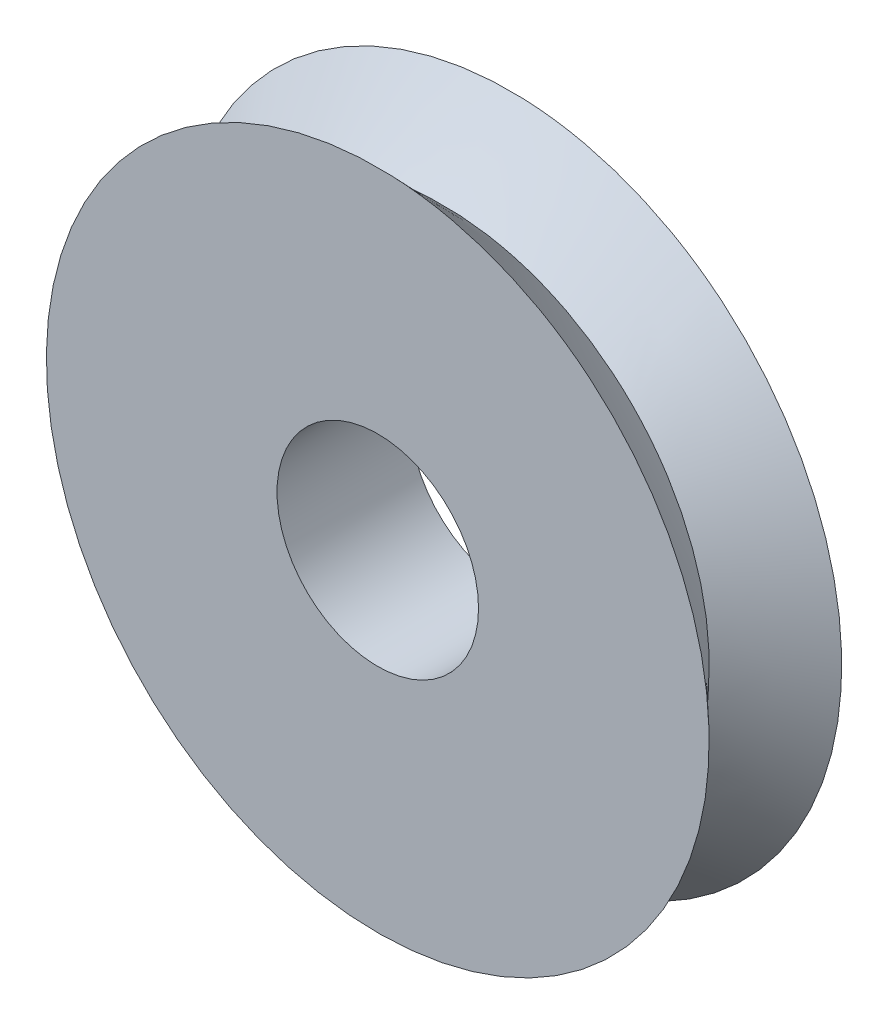
from build123d import *

# Parameters (mm, degrees)
CUT_EXTRUDE1_REACH = 9.348


with BuildPart() as part:
    # Loft1: read off the stored shape, not the designer's step
    # Loft1: loft between two sections, ruled curve by curve
    loft1_from = [
        Edge.make_bspline([(-2.206583483, -3.336313734, 0), (4.466043986, -7.749480699, 0), (8.879210951, -1.076853231, 0), (2.206583483, 3.336313734, 0), (-4.466043986, 7.749480699, 0), (-8.879210951, 1.076853231, 0), (-2.206583483, -3.336313734, 0)], [0, 0, 0, 0, 0.5, 0.5, 0.5, 1, 1, 1, 1], 3, [1, 0.333333333, 0.333333333, 1, 0.333333333, 0.333333333, 1]),
    ]
    loft1_to = [
        Edge.make_bspline([(-1.79672698, -4.666023163, 1), (7.535319346, -8.259477123, 1), (11.128773306, 1.072569203, 1), (1.79672698, 4.666023163, 1), (-7.535319346, 8.259477123, 1), (-11.128773306, -1.072569203, 1), (-1.79672698, -4.666023163, 1)], [0, 0, 0, 0, 0.5, 0.5, 0.5, 1, 1, 1, 1], 3, [1, 0.333333333, 0.333333333, 1, 0.333333333, 0.333333333, 1]),
    ]
    loft1 = Solid(Shell([*[Face.make_surface_from_curves(loft1_from[k], loft1_to[k]) for k in range(1)], Face(Wire(loft1_from)), Face(Wire(loft1_to))]))
    add(loft1)

    # Mirror1: part across plane


with BuildPart() as part_1:
    add(part.part)
    add(part.part.mirror(Plane.XY))

    # Sketch3 → Cut-Extrude1 (cut, up to next)
    with BuildSketch(Plane.XY.offset(1), mode=Mode.PRIVATE) as cut_extrude1_sk1:
        with BuildLine():
            ThreePointArc((-1.404991103, 0.58), (-1.263328936, -0.845221864), (0, -1.52))
            Line((0, -1.52), (0, 0.58))
            Line((0, 0.58), (-1.404991103, 0.58))
        make_face()
    cut_extrude1_tool1 = extrude(cut_extrude1_sk1.sketch, amount=-CUT_EXTRUDE1_REACH, mode=Mode.PRIVATE) & part_1.part
    # Sketch3 → Cut-Extrude1 (cut, up to next)
    with BuildSketch(Plane.XY.offset(1), mode=Mode.PRIVATE) as cut_extrude1_sk2:
        with BuildLine():
            Line((0, 0.58), (0, -1.52))
            ThreePointArc((0, -1.52), (1.074802307, -1.074802307), (1.52, 0))
            ThreePointArc((1.52, 0), (1.490970569, 0.295646345), (1.404991103, 0.58))
            Line((1.404991103, 0.58), (0, 0.58))
        make_face()
    cut_extrude1_tool2 = extrude(cut_extrude1_sk2.sketch, amount=-CUT_EXTRUDE1_REACH, mode=Mode.PRIVATE) & part_1.part
    # Sketch3 → Cut-Extrude1 (cut, up to next)
    with BuildSketch(Plane.XY.offset(1), mode=Mode.PRIVATE) as cut_extrude1_sk3:
        with BuildLine():
            ThreePointArc((-1.404991103, 0.58), (-1.263328936, -0.845221864), (0, -1.52))
            Line((0, -1.52), (0, 0.58))
            Line((0, 0.58), (-1.404991103, 0.58))
        make_face()
    cut_extrude1_tool3 = extrude(cut_extrude1_sk3.sketch, amount=-CUT_EXTRUDE1_REACH, mode=Mode.PRIVATE) & part_1.part
    # Sketch3 → Cut-Extrude1 (cut, up to next)
    with BuildSketch(Plane.XY.offset(1), mode=Mode.PRIVATE) as cut_extrude1_sk4:
        with BuildLine():
            Line((0, 0.58), (0, -1.52))
            ThreePointArc((0, -1.52), (1.074802307, -1.074802307), (1.52, 0))
            ThreePointArc((1.52, 0), (1.490970569, 0.295646345), (1.404991103, 0.58))
            Line((1.404991103, 0.58), (0, 0.58))
        make_face()
    cut_extrude1_tool4 = extrude(cut_extrude1_sk4.sketch, amount=-CUT_EXTRUDE1_REACH, mode=Mode.PRIVATE) & part_1.part
    # Sketch3 → Cut-Extrude1 (cut, up to next)
    with BuildSketch(Plane.XY.offset(1), mode=Mode.PRIVATE) as cut_extrude1_sk5:
        with BuildLine():
            Line((-1.404991103, 0.58), (0, 0.58))
            Line((0, 0.58), (1.404991103, 0.58))
            ThreePointArc((1.404991103, 0.58), (0, 1.52), (-1.404991103, 0.58))
        make_face()
    cut_extrude1_tool5 = extrude(cut_extrude1_sk5.sketch, amount=-CUT_EXTRUDE1_REACH, mode=Mode.PRIVATE) & part_1.part
    add(cut_extrude1_tool1.solids().sort_by_distance((-0.676103, -0.345692, 1))[0], mode=Mode.SUBTRACT)
    add(cut_extrude1_tool2.solids().sort_by_distance((0.676103, -0.345692, 1))[0], mode=Mode.SUBTRACT)
    add(cut_extrude1_tool3.solids().sort_by_distance((-0.676103, -0.345692, 1))[0], mode=Mode.SUBTRACT)
    add(cut_extrude1_tool4.solids().sort_by_distance((0.676103, -0.345692, 1))[0], mode=Mode.SUBTRACT)
    add(cut_extrude1_tool5.solids().sort_by_distance((0, 0.968177, 1))[0], mode=Mode.SUBTRACT)


solid = part_1.part
